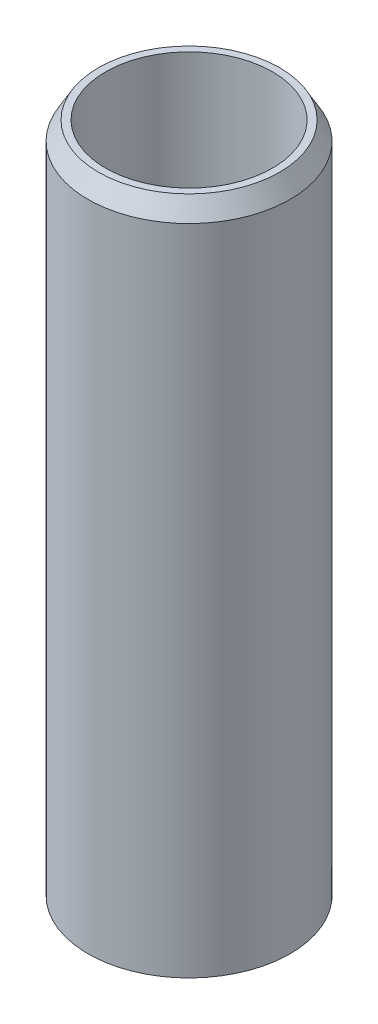
from build123d import *

# Parameters (mm, degrees)
SKETCH1_R           = 32.5
BOSS_EXTRUDE1_DEPTH = 219.233663
SKETCH2_R           = 26.832853827
CUT_EXTRUDE1_DEPTH  = 224.999774536
CHAMFER1_SIZE       = 5.867198
CHAMFER1_SIZE_2     = 3.387428


with BuildPart() as part:
    # Sketch1 → Boss-Extrude1 (new body)
    with BuildSketch(Plane(origin=(0, 0, 0), x_dir=(1, 0, 0), z_dir=(0, 1, 0))):
        with Locations(Location((0, 0, 0), (0, 0, 90))):
            Circle(SKETCH1_R)
    extrude(amount=BOSS_EXTRUDE1_DEPTH)

    # Sketch2 → Cut-Extrude1 (cut, through all)
    with BuildSketch(Plane(origin=(0, 0, 0), x_dir=(1, 0, 0), z_dir=(0, 1, 0))):
        with Locations(Location((0, 0, 0), (0, 0, 90))):
            Circle(SKETCH2_R)
    extrude(amount=CUT_EXTRUDE1_DEPTH, mode=Mode.SUBTRACT)

    # Chamfer1
    # the kernel refuses this chamfer: 5.867198, 3.387428 mm, written as the material it takes off along each edge
    with BuildSketch(Plane(origin=(0, 219.233663, 0), x_dir=(0, 0, -1), z_dir=(1, 0, 0))) as chamfer1_piece_1:
        Polygon((32.5, -CHAMFER1_SIZE), (32.5 - CHAMFER1_SIZE_2, 0), (32.5, 0), align=None)
    revolve(axis=Axis((0, 219.233663, 0), (0, 1, 0)), mode=Mode.SUBTRACT)
    with BuildSketch(Plane(origin=(0, 0, 0), x_dir=(0, 0, -1), z_dir=(1, 0, 0))) as chamfer1_piece_2:
        Polygon((32.5, CHAMFER1_SIZE_2), (32.5 - CHAMFER1_SIZE, 0), (32.5, 0), align=None)
    revolve(axis=Axis((0, 0, 0), (0, 1, 0)), mode=Mode.SUBTRACT)


solid = part.part
